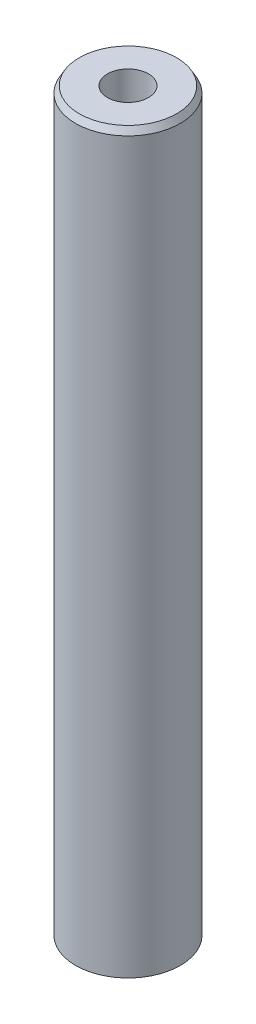
from build123d import *
from OCP.BRepFilletAPI import BRepFilletAPI_MakeChamfer

# Parameters (mm, degrees)
SKETCH1_R           = 42.5
BOSS_EXTRUDE1_DEPTH = 600
SKETCH2_R           = 16.677372656
CUT_EXTRUDE1_DEPTH  = 604.002902149
CHAMFER1_SIZE       = 5.259285974
CHAMFER1_SIZE2      = 3.036450173


with BuildPart() as part:
    # Sketch1 → Boss-Extrude1 (new body)
    with BuildSketch(Plane(origin=(0, 0, 0), x_dir=(1, 0, 0), z_dir=(0, 1, 0))):
        Circle(SKETCH1_R)
    extrude(amount=BOSS_EXTRUDE1_DEPTH)

    # Sketch2 → Cut-Extrude1 (cut, through all)
    with BuildSketch(Plane(origin=(0, 0, 0), x_dir=(1, 0, 0), z_dir=(0, 1, 0))):
        Circle(SKETCH2_R)
    extrude(amount=CUT_EXTRUDE1_DEPTH, mode=Mode.SUBTRACT)

    # Chamfer1: one chamfer whose edges measure the first distance from different faces: ONE call of the kernel's chamfer builder (chamfer() names one face for all edges)
    chamfer1_edges_1 = [part.edges().sort_by_distance(p)[0] for p in [
        (-42.5, 600, 0),
    ]]
    chamfer1_side_1 = [part.faces().sort_by_distance(p)[0] for p in [
        (-42.5, 300, 0),
    ]]
    chamfer1_edges_2 = [part.edges().sort_by_distance(p)[0] for p in [
        (-42.5, 0, 0),
    ]]
    chamfer1_side_2 = [part.faces().sort_by_distance(p)[0] for p in [
        (-41.297918472, 0, 0),
    ]]
    chamfer1 = BRepFilletAPI_MakeChamfer(part.part.solid().wrapped)
    for e in chamfer1_edges_1:
        chamfer1.Add(CHAMFER1_SIZE, CHAMFER1_SIZE2, e.wrapped, chamfer1_side_1[0].wrapped)  # the first distance lies on this face
    for e in chamfer1_edges_2:
        chamfer1.Add(CHAMFER1_SIZE, CHAMFER1_SIZE2, e.wrapped, chamfer1_side_2[0].wrapped)  # the first distance lies on this face
    add(Compound.cast(chamfer1.Shape()), mode=Mode.REPLACE)


solid = part.part
